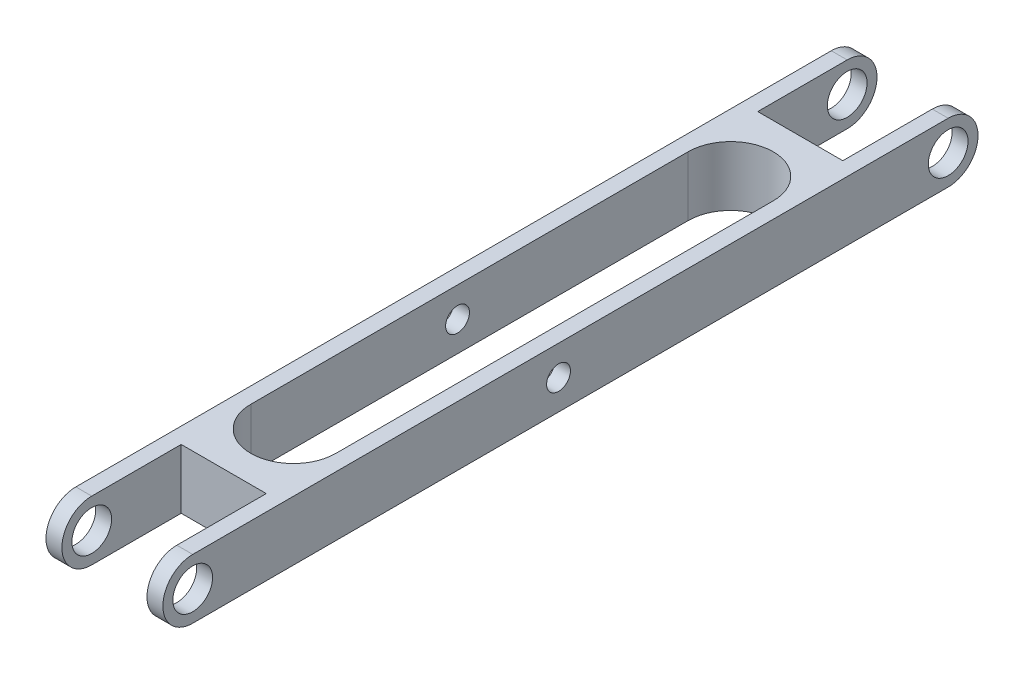
from build123d import *

# Parameters (mm, degrees)
EXTRUDE_1_DEPTH     = 29.4
SKETCH_3_W          = 21.4
SKETCH_3_H          = 30
CUT_EXTRUDE_1_DEPTH = 108.682914151
SKETCH_4_R          = 5
CUT_EXTRUDE_2_DEPTH = 107.896491991
CUT_EXTRUDE_3_DEPTH = 108.682914151
SKETCH_6_R          = 3
CUT_EXTRUDE_4_DEPTH = 107.896491991


with BuildPart() as part:
    # 草图2 → 凸台-拉伸1 (new body)
    with BuildSketch(Plane(origin=(0, 0, 0), x_dir=(0, 0, -1), z_dir=(1, 0, 0))):
        with BuildLine():
            Line((-95, -7.5), (95, -7.5))
            ThreePointArc((95, -7.5), (102.5, 0), (95, 7.5))
            Line((95, 7.5), (-95, 7.5))
            ThreePointArc((-95, 7.5), (-102.5, 0), (-95, -7.5))
        make_face()
    extrude(amount=EXTRUDE_1_DEPTH)

    # 草图3 → 切除-拉伸1 (cut, through all)
    with BuildSketch(Plane(origin=(0, 7.5, 0), x_dir=(1, 0, 0), z_dir=(0, 1, 0))):
        with Locations((14.7, -87.5)):
            Rectangle(SKETCH_3_W, SKETCH_3_H)
        with Locations((14.7, 87.5)):
            Rectangle(SKETCH_3_W, SKETCH_3_H)
    extrude(amount=-CUT_EXTRUDE_1_DEPTH, mode=Mode.SUBTRACT)

    # 草图4 → 切除-拉伸2 (cut, through all)
    with BuildSketch(Plane(origin=(29.4, 0, 0), x_dir=(0, 0, -1), z_dir=(1, 0, 0))):
        with Locations((-95, 0)):
            Circle(SKETCH_4_R)
        with Locations((95, 0)):
            Circle(SKETCH_4_R)
    extrude(amount=-CUT_EXTRUDE_2_DEPTH, mode=Mode.SUBTRACT)

    # 草图5 → 切除-拉伸3 (cut, through all)
    with BuildSketch(Plane.XZ.offset(7.5)):
        with BuildLine():
            Line((25.4, 55), (25.4, -55))
            ThreePointArc((25.4, -55), (14.7, -65.7), (4, -55))
            Line((4, -55), (4, 55))
            ThreePointArc((4, 55), (14.7, 65.7), (25.4, 55))
        make_face()
    extrude(amount=-CUT_EXTRUDE_3_DEPTH, mode=Mode.SUBTRACT)

    # 草图6 → 切除-拉伸4 (cut, through all)
    with BuildSketch(Plane.ZY):
        with Locations((3, 0)):
            Circle(SKETCH_6_R)
    extrude(amount=-CUT_EXTRUDE_4_DEPTH, mode=Mode.SUBTRACT)


solid = part.part
